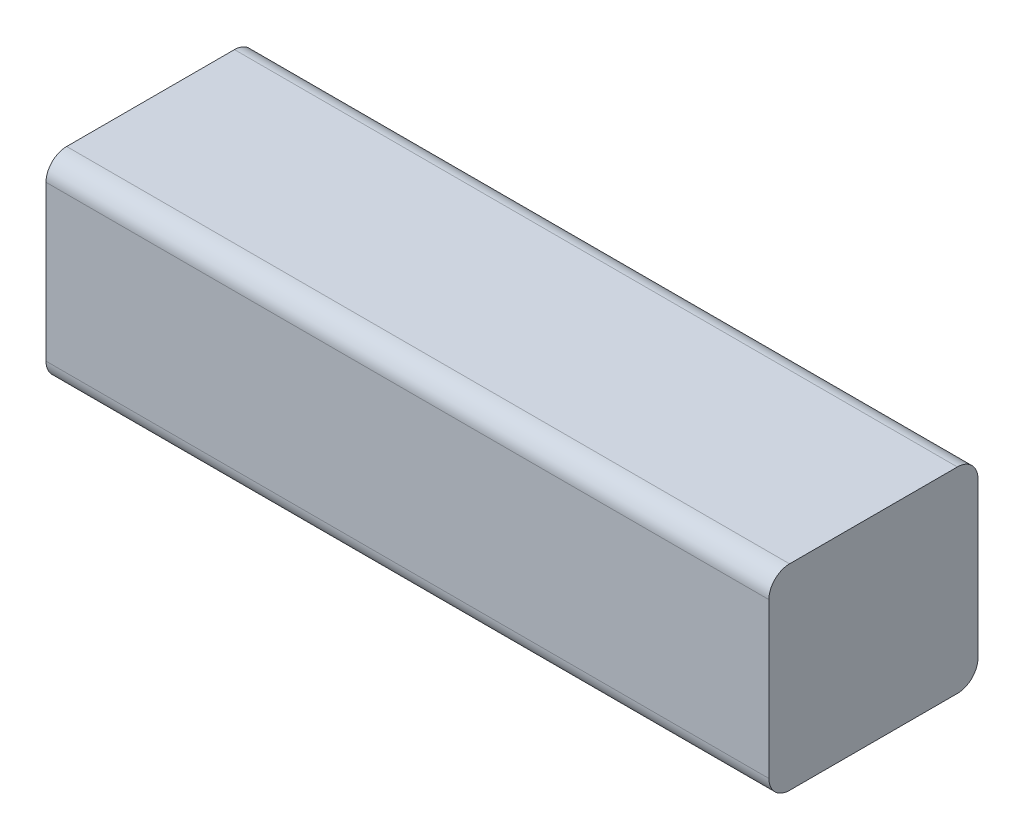
from build123d import *

# Parameters (mm, degrees)
SKETCH1_W           = 70
SKETCH1_H           = 19
BOSS_EXTRUDE1_DEPTH = 20.25
FILLET1_R           = 2


with BuildPart() as part:
    # Sketch1 → Boss-Extrude1 (new body)
    with BuildSketch(Plane.XY):
        with Locations((-238.238095238, 54.285714286)):
            Rectangle(SKETCH1_W, SKETCH1_H)
    extrude(amount=BOSS_EXTRUDE1_DEPTH)

    # Fillet1
    fillet1_edges = [part.edges().sort_by_distance(p)[0] for p in [
        (-238.238095238, 63.785714286, 0),
        (-238.238095238, 44.785714286, 0),
        (-238.238095238, 44.785714286, 20.25),
        (-238.238095238, 63.785714286, 20.25),
    ]]
    fillet(fillet1_edges, radius=FILLET1_R)


solid = part.part
